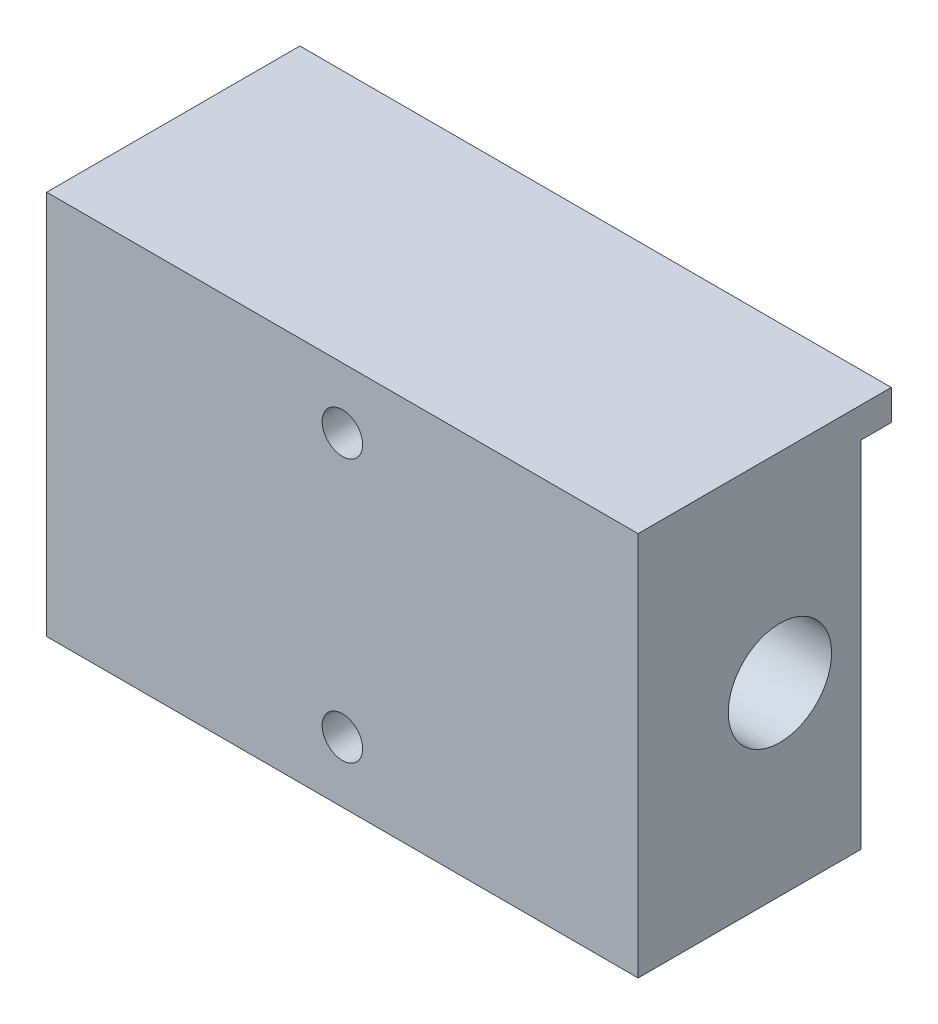
from build123d import *

# Parameters (mm, degrees)
CROQUIS1_W                         = 58.4
CROQUIS1_H                         = 38
SALIENTE_EXTRUIR1_DEPTH            = 22
CROQUIS2_R                         = 5.1
CORTAR_EXTRUIR1_DEPTH              = 74.065450112
TALADROS_DE_ESPIGA_DE_4_0MM2_D     = 4
TALADROS_DE_ESPIGA_DE_4_0MM2_DEPTH = 12
TALADROS_DE_ESPIGA_DE_4_0MM2_TIP   = 1.201721238
CROQUIS6_W                         = 58.4
CROQUIS6_H                         = 3
SALIENTE_EXTRUIR2_DEPTH            = 3


with BuildPart() as part:
    # Croquis1 → Saliente-Extruir1 (new body)
    with BuildSketch(Plane.XY):
        with Locations((29.2, 19)):
            Rectangle(CROQUIS1_W, CROQUIS1_H)
    extrude(amount=SALIENTE_EXTRUIR1_DEPTH)

    # Croquis2 → Cortar-Extruir1 (cut, through all)
    with BuildSketch(Plane(origin=(58.4, 0, 0), x_dir=(0, 0, -1), z_dir=(1, 0, 0))):
        with Locations((-8, 18.236268226)):
            Circle(CROQUIS2_R)
    extrude(amount=-CORTAR_EXTRUIR1_DEPTH, mode=Mode.SUBTRACT)

    # Taladros de espiga de Ø4.0mm2
    with Locations(Plane.XY.offset(22)):
        with Locations((29.2, 6), (29.2, 32)):
            Hole(TALADROS_DE_ESPIGA_DE_4_0MM2_D / 2, depth=TALADROS_DE_ESPIGA_DE_4_0MM2_DEPTH)
            with Locations((0, 0, -(TALADROS_DE_ESPIGA_DE_4_0MM2_DEPTH + TALADROS_DE_ESPIGA_DE_4_0MM2_TIP / 2))):  # 118° drill point
                Cone(0, TALADROS_DE_ESPIGA_DE_4_0MM2_D / 2, TALADROS_DE_ESPIGA_DE_4_0MM2_TIP, mode=Mode.SUBTRACT)

    # Croquis6 → Saliente-Extruir2 (add)
    with BuildSketch(Plane(origin=(0, 0, 0), x_dir=(-1, 0, 0), z_dir=(0, 0, -1))):
        with Locations((-29.2, 36.5)):
            Rectangle(CROQUIS6_W, CROQUIS6_H)
    extrude(amount=SALIENTE_EXTRUIR2_DEPTH)


solid = part.part
